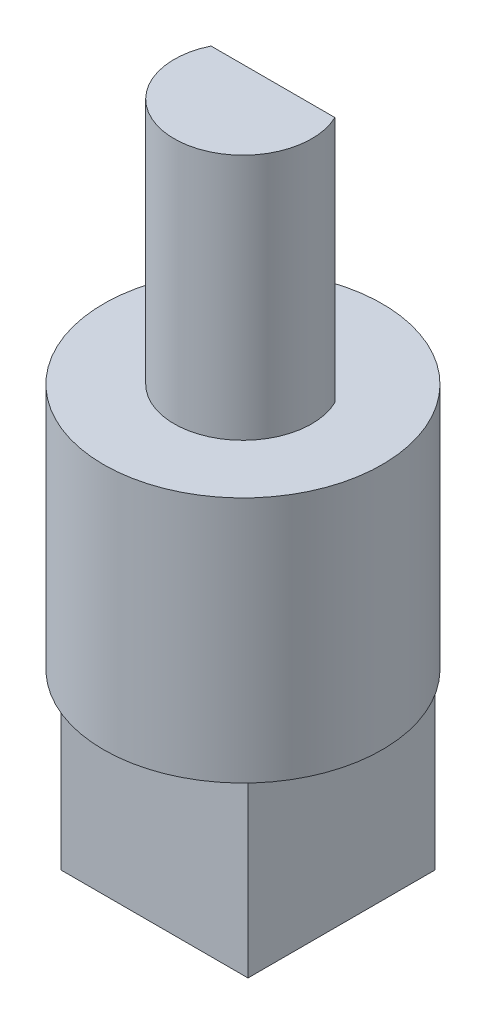
from build123d import *

# Parameters (mm, degrees)
SKETCH1_W           = 5.3
SKETCH1_H           = 5.3
BOSS_EXTRUDE1_DEPTH = 5
SKETCH2_R           = 3.95
BOSS_EXTRUDE2_DEPTH = 7
SKETCH3_R           = 1.95
BOSS_EXTRUDE3_DEPTH = 7
CUT_EXTRUDE1_START  = -7
CUT_EXTRUDE1_DEPTH  = 7


with BuildPart() as part:
    # Sketch1 → Boss-Extrude1 (new body)
    with BuildSketch(Plane(origin=(0, 0, 0), x_dir=(1, 0, 0), z_dir=(0, 1, 0))):
        with Locations((0, 0.143071786)):
            Rectangle(SKETCH1_W, SKETCH1_H)
    extrude(amount=BOSS_EXTRUDE1_DEPTH)

    # Sketch2 → Boss-Extrude2 (add)
    with BuildSketch(Plane(origin=(0, 5, 0), x_dir=(1, 0, 0), z_dir=(0, 1, 0))):
        Circle(SKETCH2_R)
    extrude(amount=BOSS_EXTRUDE2_DEPTH)

    # Sketch3 → Boss-Extrude3 (add)
    with BuildSketch(Plane(origin=(0, 12, 0), x_dir=(1, 0, 0), z_dir=(0, 1, 0))):
        Circle(SKETCH3_R)
    extrude(amount=BOSS_EXTRUDE3_DEPTH)

    # Sketch4 → Cut-Extrude1 (cut)
    with BuildSketch(Plane(origin=(0, 19, 0), x_dir=(1, 0, 0), z_dir=(0, 1, 0)).offset(CUT_EXTRUDE1_START)):
        with BuildLine():
            Line((-1.754992877, 0.85), (1.754992877, 0.85))
            ThreePointArc((1.754992877, 0.85), (0, 1.95), (-1.754992877, 0.85))
        make_face()
    extrude(amount=CUT_EXTRUDE1_DEPTH, mode=Mode.SUBTRACT)


solid = part.part
